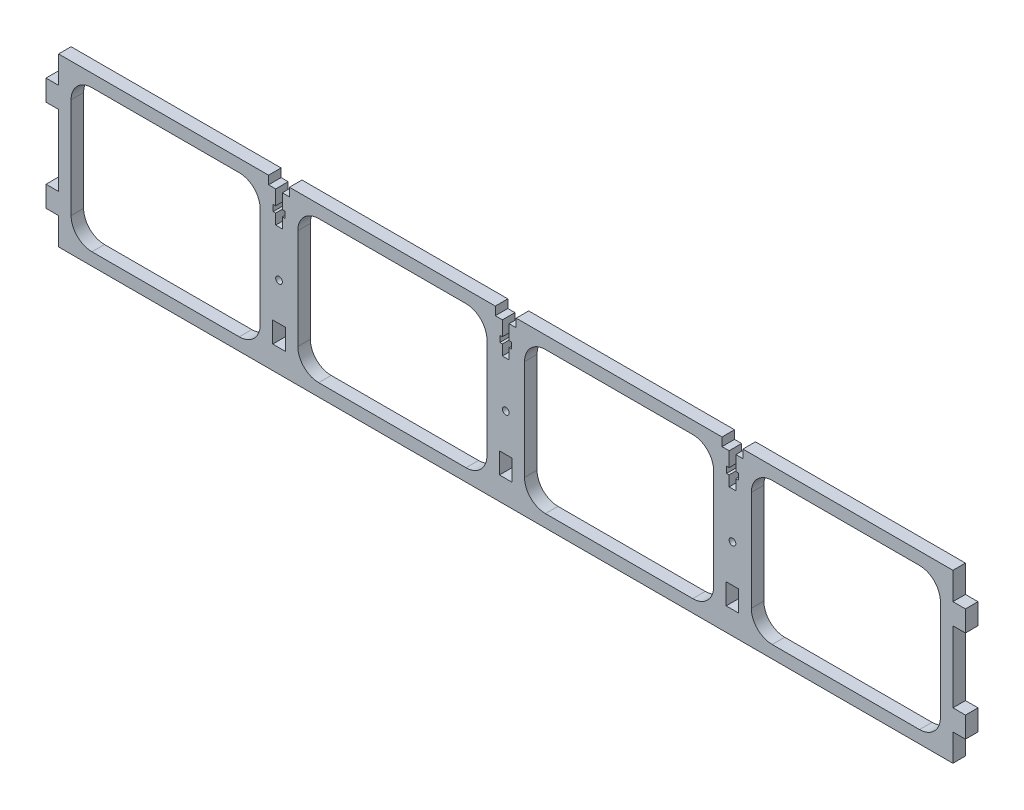
from build123d import *

# Parameters (mm, degrees)
SKETCH1_W           = 428
SKETCH1_H           = 80
BOSS_EXTRUDE1_DEPTH = 6
CUT_EXTRUDE1_REACH  = 219.789
LPATTERN1_COUNT     = 4
LPATTERN1_PITCH     = 108.5
SKETCH3_R           = 1.6
SKETCH3_W           = 6
SKETCH3_H           = 10
CUT_EXTRUDE2_DEPTH  = 218.788888605
SKETCH4_W           = 6
SKETCH4_H           = 10
BOSS_EXTRUDE2_DEPTH = 6
SKETCH5_W           = 10
SKETCH5_H           = 6
CUT_EXTRUDE3_DEPTH  = 4
CUT_EXTRUDE4_REACH  = 225.687


with BuildPart() as part:
    # Sketch1 → Boss-Extrude1 (new body)
    with BuildSketch(Plane.XY):
        Rectangle(SKETCH1_W, SKETCH1_H)
    extrude(amount=BOSS_EXTRUDE1_DEPTH)

    # Sketch2 → Cut-Extrude1 (cut, up to next)
    with BuildSketch(Plane.XY.offset(6), mode=Mode.PRIVATE) as cut_extrude1_sk1:
        with BuildLine():
            ThreePointArc((-127.5, -34), (-120.428932188, -31.071067812), (-117.5, -24))
            Line((-117.5, -24), (-117.5, 24))
            ThreePointArc((-117.5, 24), (-120.428932188, 31.071067812), (-127.5, 34))
            Line((-127.5, 34), (-198, 34))
            ThreePointArc((-198, 34), (-205.071067812, 31.071067812), (-208, 24))
            Line((-208, 24), (-208, -24))
            ThreePointArc((-208, -24), (-205.071067812, -31.071067812), (-198, -34))
            Line((-198, -34), (-127.5, -34))
        make_face()
    cut_extrude1_tool1 = extrude(cut_extrude1_sk1.sketch, amount=-CUT_EXTRUDE1_REACH, mode=Mode.PRIVATE) & part.part
    cut_extrude1 = cut_extrude1_tool1.solids().sort_by_distance((-162.75, 0, 6))[0]
    add(cut_extrude1, mode=Mode.SUBTRACT)

    # LPattern1: Cut-Extrude1 ×4
    with Locations(*[(i * LPATTERN1_PITCH, 0, 0) for i in range(1, LPATTERN1_COUNT)]):
        add(cut_extrude1, mode=Mode.SUBTRACT)

    # Sketch3 → Cut-Extrude2 (cut, through all)
    with BuildSketch(Plane(origin=(0, 0, 0), x_dir=(-1, 0, 0), z_dir=(0, 0, -1))):
        with Locations((108.5, -1)):
            Circle(SKETCH3_R)
        with Locations((0, -1)):
            Circle(SKETCH3_R)
        with Locations((-108.5, -1)):
            Circle(SKETCH3_R)
        with Locations((-108.5, -24)):
            Rectangle(SKETCH3_W, SKETCH3_H)
        with Locations((0, -24)):
            Rectangle(SKETCH3_W, SKETCH3_H)
        with Locations((108.5, -24)):
            Rectangle(SKETCH3_W, SKETCH3_H)
    extrude(amount=-CUT_EXTRUDE2_DEPTH, mode=Mode.SUBTRACT)

    # Sketch4 → Boss-Extrude2 (add)
    with BuildSketch(Plane(origin=(0, 0, 0), x_dir=(-1, 0, 0), z_dir=(0, 0, -1))):
        with Locations((-217, 22)):
            Rectangle(SKETCH4_W, SKETCH4_H)
        with Locations((-217, -22)):
            Rectangle(SKETCH4_W, SKETCH4_H)
        with Locations((217, -22)):
            Rectangle(SKETCH4_W, SKETCH4_H)
        with Locations((217, 22)):
            Rectangle(SKETCH4_W, SKETCH4_H)
    extrude(amount=-BOSS_EXTRUDE2_DEPTH)

    # Sketch5 → Cut-Extrude3 (cut)
    with BuildSketch(Plane(origin=(0, 40, 0), x_dir=(1, 0, 0), z_dir=(0, 1, 0))):
        with Locations((-108.5, -3)):
            Rectangle(SKETCH5_W, SKETCH5_H)
        with Locations((0, -3)):
            Rectangle(SKETCH5_W, SKETCH5_H)
        with Locations((108.5, -3)):
            Rectangle(SKETCH5_W, SKETCH5_H)
    extrude(amount=-CUT_EXTRUDE3_DEPTH, mode=Mode.SUBTRACT)

    # Sketch6 → Cut-Extrude4 (cut, up to next)
    with BuildSketch(Plane(origin=(0, 0, 0), x_dir=(-1, 0, 0), z_dir=(0, 0, -1)), mode=Mode.PRIVATE) as cut_extrude4_sk1:
        Polygon((-110.1, 36), (-110.1, 29), (-111.3, 29), (-111.3, 26), (-110.1, 26), (-110.1, 21), (-106.9, 21), (-106.9, 26), (-105.7, 26), (-105.7, 29), (-106.9, 29), (-106.9, 36), align=None)
    cut_extrude4_tool1 = extrude(cut_extrude4_sk1.sketch, amount=-CUT_EXTRUDE4_REACH, mode=Mode.PRIVATE) & part.part
    # Sketch6 → Cut-Extrude4 (cut, up to next)
    with BuildSketch(Plane(origin=(0, 0, 0), x_dir=(-1, 0, 0), z_dir=(0, 0, -1)), mode=Mode.PRIVATE) as cut_extrude4_sk2:
        Polygon((-1.6, 29), (-2.8, 29), (-2.8, 26), (-1.6, 26), (-1.6, 21), (1.6, 21), (1.6, 26), (2.8, 26), (2.8, 29), (1.6, 29), (1.6, 36), (-1.6, 36), align=None)
    cut_extrude4_tool2 = extrude(cut_extrude4_sk2.sketch, amount=-CUT_EXTRUDE4_REACH, mode=Mode.PRIVATE) & part.part
    # Sketch6 → Cut-Extrude4 (cut, up to next)
    with BuildSketch(Plane(origin=(0, 0, 0), x_dir=(-1, 0, 0), z_dir=(0, 0, -1)), mode=Mode.PRIVATE) as cut_extrude4_sk3:
        Polygon((106.9, 36), (106.9, 29), (105.7, 29), (105.7, 26), (106.9, 26), (106.9, 21), (110.1, 21), (110.1, 26), (111.3, 26), (111.3, 29), (110.1, 29), (110.1, 36), align=None)
    cut_extrude4_tool3 = extrude(cut_extrude4_sk3.sketch, amount=-CUT_EXTRUDE4_REACH, mode=Mode.PRIVATE) & part.part
    add(cut_extrude4_tool1.solids().sort_by_distance((108.5, 28.369565, 0))[0], mode=Mode.SUBTRACT)
    add(cut_extrude4_tool2.solids().sort_by_distance((0, 28.369565, 0))[0], mode=Mode.SUBTRACT)
    add(cut_extrude4_tool3.solids().sort_by_distance((-108.5, 28.369565, 0))[0], mode=Mode.SUBTRACT)


solid = part.part
